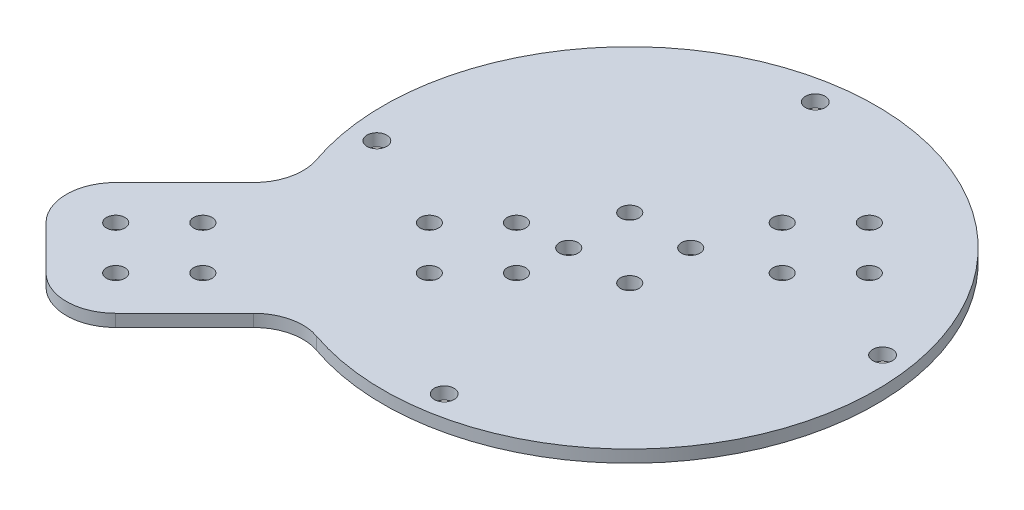
from build123d import *

# Parameters (mm, degrees)
SKETCH_1_R          = 40
SKETCH_1_R_2        = 1.5
SKETCH_1_R_3        = 1.6
EXTRUDE_9_DEPTH     = 2
SKETCH_2_R          = 1.5
CUT_EXTRUDE_1_DEPTH = 2
FILLET_2_OUTLINE_R  = 1.5
FILLET_2_DEPTH      = 2


with BuildPart() as part:
    # 草图1 → 凸台-拉伸9 (new body)
    with BuildSketch(Plane(origin=(0, 0, 0), x_dir=(1, 0, 0), z_dir=(0, 1, 0))):
        with Locations(Location((0, 0, 0), (0, 0, 270))):
            Circle(SKETCH_1_R)
        with Locations(Location((-12.727922062, -5.656854248, 0), (0, 0, 270))):
            Circle(SKETCH_1_R_2, mode=Mode.SUBTRACT)
        with Locations(Location((-5.656854248, -12.727922062, 0), (0, 0, 270))):
            Circle(SKETCH_1_R_2, mode=Mode.SUBTRACT)
        with Locations(Location((-19.798989874, -12.727922061, 0), (0, 0, 270))):
            Circle(SKETCH_1_R_2, mode=Mode.SUBTRACT)
        with Locations(Location((-12.727922061, -19.798989874, 0), (0, 0, 270))):
            Circle(SKETCH_1_R_2, mode=Mode.SUBTRACT)
        with Locations(Location((4.949747468, 4.949747468, 0), (0, 0, 270))):
            Circle(SKETCH_1_R_2, mode=Mode.SUBTRACT)
        with Locations(Location((-4.949747468, 4.949747468, 0), (0, 0, 270))):
            Circle(SKETCH_1_R_2, mode=Mode.SUBTRACT)
        with Locations(Location((-4.949747468, -4.949747468, 0), (0, 0, 270))):
            Circle(SKETCH_1_R_2, mode=Mode.SUBTRACT)
        with Locations(Location((4.949747468, -4.949747468, 0), (0, 0, 270))):
            Circle(SKETCH_1_R_2, mode=Mode.SUBTRACT)
        with Locations(Location((35.582997469, 5.463541991, 0), (0, 0, 270))):
            Circle(SKETCH_1_R_3, mode=Mode.SUBTRACT)
        with Locations(Location((5.463541991, -35.582997469, 0), (0, 0, 270))):
            Circle(SKETCH_1_R_3, mode=Mode.SUBTRACT)
        with Locations(Location((-35.582997469, -5.463541991, 0), (0, 0, 270))):
            Circle(SKETCH_1_R_3, mode=Mode.SUBTRACT)
        with Locations(Location((-5.463541991, 35.582997469, 0), (0, 0, 270))):
            Circle(SKETCH_1_R_3, mode=Mode.SUBTRACT)
    extrude(amount=EXTRUDE_9_DEPTH)

    # 草图2 → 切除-拉伸1 (cut)
    with BuildSketch(Plane(origin=(0, 2, 0), x_dir=(1, 0, 0), z_dir=(0, 1, 0))):
        with Locations(Location((8.838834765, 15.909902577, 0), (0, 0, 270))):
            Circle(SKETCH_2_R)
        with Locations(Location((15.909902577, 8.838834765, 0), (0, 0, 270))):
            Circle(SKETCH_2_R)
        with Locations(Location((15.909902576, 22.980970389, 0), (0, 0, 270))):
            Circle(SKETCH_2_R)
        with Locations(Location((22.980970389, 15.909902576, 0), (0, 0, 270))):
            Circle(SKETCH_2_R)
    extrude(amount=-CUT_EXTRUDE_1_DEPTH, mode=Mode.SUBTRACT)

    # 圆角2: read off the stored shape, not the designer's step
    # 圆角2 outline → 圆角2 (add)
    with BuildSketch(Plane(origin=(0, 0, 0), x_dir=(1, 0, 0), z_dir=(0, 1, 0))):
        with BuildLine():
            ThreePointArc((-37.808106107, -13.059368767), (-37.573895805, -17.467074044), (-39.712873079, -21.32809677))
            Line((-39.712873079, -21.32809677), (-50.911688244, -32.526911935))
            ThreePointArc((-50.911688244, -32.526911935), (-53.254833995, -38.183766185), (-50.911688244, -43.840620434))
            Line((-50.911688244, -43.840620434), (-43.840620432, -50.911688246))
            ThreePointArc((-43.840620432, -50.911688246), (-38.183766183, -53.254833997), (-32.526911933, -50.911688246))
            Line((-32.526911933, -50.911688246), (-21.328096767, -39.71287308))
            ThreePointArc((-21.328096767, -39.71287308), (-17.467074041, -37.573895806), (-13.059368765, -37.808106108))
            ThreePointArc((-13.059368765, -37.808106108), (-28.284271247, -28.284271248), (-37.808106107, -13.059368767))
        make_face()
        with Locations((-38.18376618, -45.254833999)):
            Circle(FILLET_2_OUTLINE_R, mode=Mode.SUBTRACT)
        with Locations((-45.254833993, -38.183766188)):
            Circle(FILLET_2_OUTLINE_R, mode=Mode.SUBTRACT)
        with Locations((-31.112698372, -38.183766184)):
            Circle(FILLET_2_OUTLINE_R, mode=Mode.SUBTRACT)
        with Locations((-38.183766184, -31.112698372)):
            Circle(FILLET_2_OUTLINE_R, mode=Mode.SUBTRACT)
    extrude(amount=FILLET_2_DEPTH)


solid = part.part
